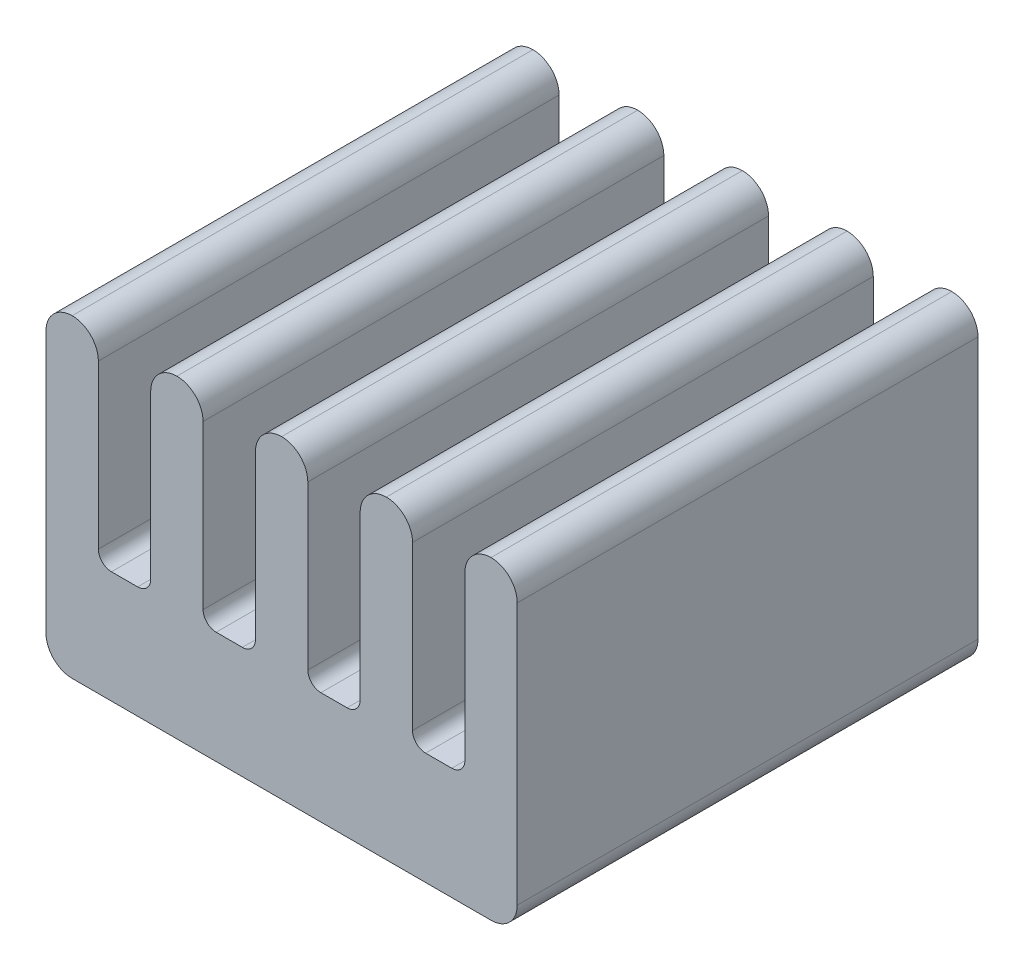
from build123d import *

# Parameters (mm, degrees)
SKETCH1_W           = 9
SKETCH1_H           = 8.8
BOSS_EXTRUDE1_DEPTH = 6
SKETCH2_W           = 1
SKETCH2_H           = 3.86
CUT_EXTRUDE1_DEPTH  = 12.562439189
LPATTERN1_COUNT     = 4
LPATTERN1_PITCH     = 2
FILLET1_R           = 0.25
FILLET2_R           = 0.5


with BuildPart() as part:
    # Sketch1 → Boss-Extrude1 (new body)
    with BuildSketch(Plane(origin=(0, 0, 0), x_dir=(1, 0, 0), z_dir=(0, 1, 0))):
        Rectangle(SKETCH1_W, SKETCH1_H)
    extrude(amount=BOSS_EXTRUDE1_DEPTH)

    # Sketch2 → Cut-Extrude1 (cut, through all)
    with BuildSketch(Plane.XY.offset(4.4)):
        with Locations((-3, 4.07)):
            Rectangle(SKETCH2_W, SKETCH2_H)
    cut_extrude1 = extrude(amount=-CUT_EXTRUDE1_DEPTH, mode=Mode.SUBTRACT)

    # LPattern1: Cut-Extrude1 ×4
    with Locations(*[(i * LPATTERN1_PITCH, 0, 0) for i in range(1, LPATTERN1_COUNT)]):
        add(cut_extrude1, mode=Mode.SUBTRACT)

    # Fillet1
    fillet1_edges = [part.edges().sort_by_distance(p)[0] for p in [
        (-2.5, 2.14, 0),
        (-3.5, 2.14, 0),
        (-0.5, 2.14, 0),
        (-1.5, 2.14, 0),
        (1.5, 2.14, 0),
        (0.5, 2.14, 0),
        (3.5, 2.14, 0),
        (2.5, 2.14, 0),
    ]]
    fillet(fillet1_edges, radius=FILLET1_R)

    # Fillet2
    fillet2_edges = [part.edges().sort_by_distance(p)[0] for p in [
        (-4.5, 6, 0),
        (-3.5, 6, 0),
        (-2.5, 6, 0),
        (-1.5, 6, 0),
        (-0.5, 6, 0),
        (0.5, 6, 0),
        (1.5, 6, 0),
        (2.5, 6, 0),
        (3.5, 6, 0),
        (4.5, 6, 0),
        (-4.5, 0, 0),
        (4.5, 0, 0),
    ]]
    fillet(fillet2_edges, radius=FILLET2_R - 0.0001)  # a hair under: the kernel refuses the full size


solid = part.part
